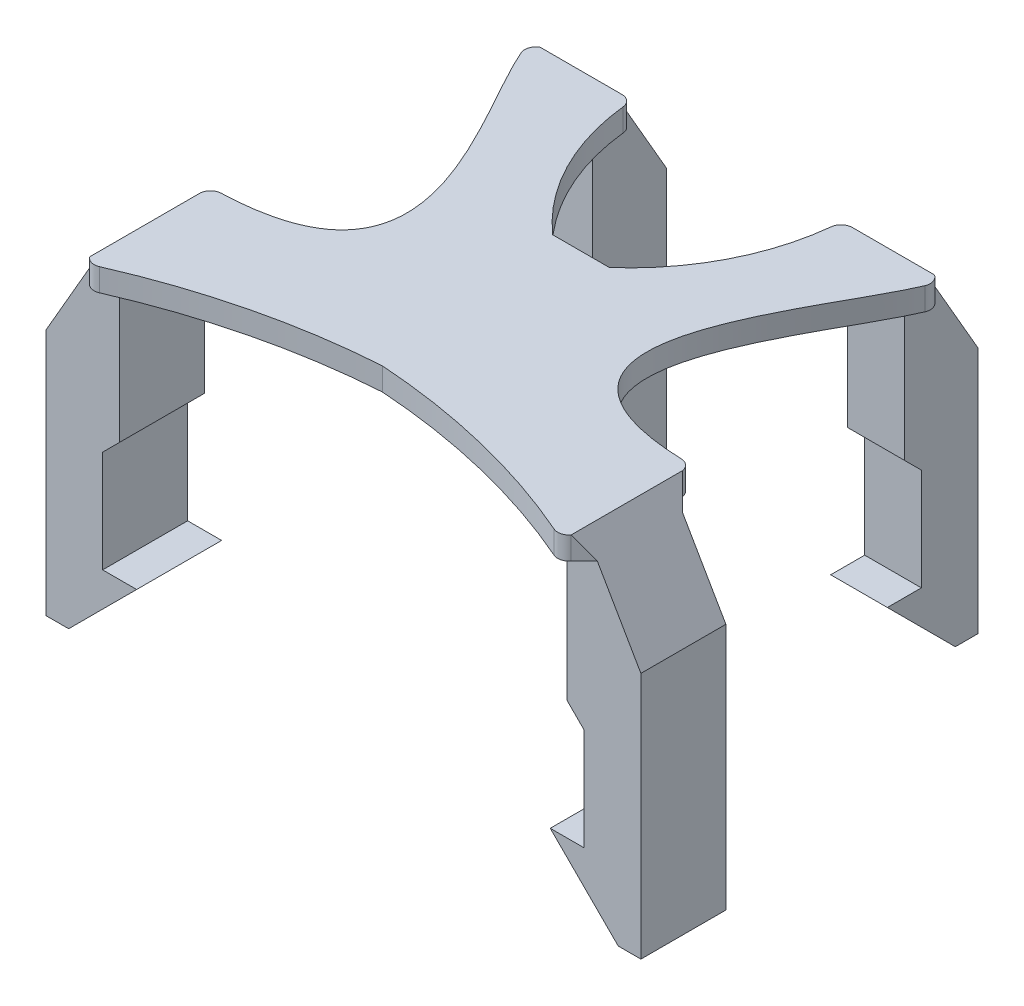
from build123d import *

# Parameters (mm, degrees)
SKETCH1_W           = 42.5
SKETCH1_H           = 44.5
BOSS_EXTRUDE1_DEPTH = 2
BOSS_EXTRUDE2_START = -27.25
BOSS_EXTRUDE2_DEPTH = 7.5
BOSS_EXTRUDE3_START = -5
BOSS_EXTRUDE3_DEPTH = 5
CUT_EXTRUDE3_DEPTH  = 5
CHAMFER1_SIZE       = 1.15
FILLET1_R           = 1


with BuildPart() as part:
    # Sketch1 → Boss-Extrude1 (new body)
    with BuildSketch(Plane(origin=(0, 0, 0), x_dir=(1, 0, 0), z_dir=(0, 1, 0))):
        Rectangle(SKETCH1_W, SKETCH1_H)
    extrude(amount=BOSS_EXTRUDE1_DEPTH)

    # Sketch2 → Boss-Extrude2 (add)
    with BuildSketch(Plane(origin=(0, 0, -22.25), x_dir=(-1, 0, 0), z_dir=(0, 0, -1)).offset(BOSS_EXTRUDE2_START)):
        Polygon((21.25, -22.5), (18.25, -22.5), (24.25, -28.5), (26.25, -28.5), (26.25, -18), (26.25, -6.660254038), (21.25, 2), (21.25, 0), (19.75, 0), (19.75, -12), (21.25, -13.5), align=None)
    boss_extrude2 = extrude(amount=-BOSS_EXTRUDE2_DEPTH)

    # Mirror1: Boss-Extrude2 across plane
    add(boss_extrude2.mirror(Plane(origin=(0, 0, 0), x_dir=(0, 0, 1), z_dir=(1, 0, 0))))

    # Sketch4 → Boss-Extrude3 (add)
    with BuildSketch(Plane(origin=(21.25, 0, 0), x_dir=(0, 0, -1), z_dir=(1, 0, 0)).offset(BOSS_EXTRUDE3_START)):
        Polygon((27.25, -6.660254038), (27.25, -28.5), (25.25, -28.5), (19.25, -22.5), (22.25, -22.5), (22.25, -13.5), (20.75, -12), (20.75, 0), (22.25, 0), (22.25, 2), align=None)
    boss_extrude3 = extrude(amount=-BOSS_EXTRUDE3_DEPTH)

    # Mirror2: Boss-Extrude3 across plane
    add(boss_extrude3.mirror(Plane(origin=(0, 0, 0), x_dir=(0, 0, 1), z_dir=(1, 0, 0))))

    # Sketch5 → Cut-Extrude3 (cut)
    with BuildSketch(Plane(origin=(0, 2, 0), x_dir=(1, 0, 0), z_dir=(0, 1, 0))):
        with BuildLine():
            ThreePointArc((0, -9.063025703), (-10.875563664, -10.802203854), (-21.25, -14.5))
            Line((-21.25, -14.5), (-21.25, -22.25))
            Line((-21.25, -22.25), (21.25, -22.25))
            Line((21.25, -22.25), (21.25, -14.5))
            ThreePointArc((21.25, -14.5), (10.875563664, -10.802203854), (0, -9.063025703))
        make_face()
        with BuildLine():
            Line((-21.25, 22.25), (-21.25, -3))
            add(Edge.make_bspline(
                [(-18.25, 22.25), (-16.81830639, 16.418600695), (-0.036255197, -2.877473786), (-21.25, -3)],
                knots=[0, 0, 0, 0, 1, 1, 1, 1], degree=3))
            Line((-18.25, 22.25), (-21.25, 22.25))
        make_face()
        with BuildLine():
            Line((-2.5, 8.468152214), (2.5, 8.468152214))
            ThreePointArc((2.5, 8.468152214), (7.249445146, 14.685907684), (9.25, 22.25))
            Line((9.25, 22.25), (-9.25, 22.25))
            ThreePointArc((-9.25, 22.25), (-7.249445146, 14.685907684), (-2.5, 8.468152214))
        make_face()
        with BuildLine():
            add(Edge.make_bspline(
                [(18.25, 22.25), (16.81830639, 16.418600695), (0.036255197, -2.877473786), (21.25, -3)],
                knots=[0, 0, 0, 0, 1, 1, 1, 1], degree=3))
            Line((21.25, -3), (21.25, 22.25))
            Line((21.25, 22.25), (18.25, 22.25))
        make_face()
    extrude(amount=-CUT_EXTRUDE3_DEPTH, mode=Mode.SUBTRACT)

    # Chamfer1
    chamfer1_edges = [part.edges().sort_by_distance(p)[0] for p in [
        (-11.25, 1, -22.25),
        (-21.25, 1, 12.5),
        (-21.25, 1, 5),
        (21.25, 1, 5),
        (21.25, 1, 12.5),
        (11.25, 1, -22.25),
        (16.25, 1, -22.25),
        (-16.25, 1, -22.25),
    ]]
    chamfer(chamfer1_edges, length=CHAMFER1_SIZE)

    # Fillet1
    # the kernel refuses this fillet: 1 mm, written as the material it takes off along each edge
    with BuildSketch(Plane(origin=(-21.25, 4.391127169, 3), x_dir=(0, 0, 1), z_dir=(0, -1, 0))) as fillet1_piece_1:
        with BuildLine():
            CenterArc((0.980089216, -0.991502292), FILLET1_R, 97.474747775, 80.505389302)
            Line((-0.019289453, -0.956256336), (-0.039277026, -0.955551417))
            ThreePointArc((-0.039277026, -0.955551417), (-0.026119359, -0.477798689), (-0.019999666, 0.000115514))
            Line((-0.019999666, 0.000115514), (0, 0.02))
            ThreePointArc((0, 0.02), (0.425, 0.02), (0.847398216, 0.019830046))
            Line((0.847398216, 0.019830046), (0.85, 0))
        make_face()
    extrude(amount=6.782254339, mode=Mode.SUBTRACT)
    with BuildSketch(Plane(origin=(-18.25, 5.318683713, -22.25), x_dir=(0.3309539081211192, 0, 0.9436469205690006), z_dir=(0, -1, 0))) as fillet1_piece_2:
        with BuildLine():
            CenterArc((1.261964238, -0.997851962), FILLET1_R, 86.243906852, 82.467431806)
            Line((0.281310822, -0.802099882), (0.261697754, -0.798184841))
            ThreePointArc((0.261697754, -0.798184841), (0.121782473, -0.407669019), (-0.018872938, -0.006619078))
            Line((-0.018872938, -0.006619078), (-0.001928232, 0.019906831))
            ThreePointArc((-0.001928232, 0.019906831), (0.664077557, 0.04586364), (1.32878367, 0.019957039))
            Line((1.32878367, 0.019957039), (1.327473485, 0))
        make_face()
    extrude(amount=8.637367425, mode=Mode.SUBTRACT)
    with BuildSketch(Plane(origin=(-9.25, 4.236352912, -22.25), x_dir=(-1, 0, 0), z_dir=(0, -1, 0))) as fillet1_piece_3:
        with BuildLine():
            CenterArc((0.919243583, -0.997599783), FILLET1_R, 93.970542278, 79.932192876)
            Line((-0.075099433, -0.891383179), (-0.094986293, -0.889258846))
            ThreePointArc((-0.094986293, -0.889258846), (-0.052494869, -0.444432453), (-0.01996196, 0.001232949))
            Line((-0.01996196, 0.001232949), (0, 0.02))
            ThreePointArc((0, 0.02), (0.425, 0.02), (0.848615128, 0.019951996))
            Line((0.848615128, 0.019951996), (0.85, 0))
        make_face()
    extrude(amount=6.472705825, mode=Mode.SUBTRACT)
    with BuildSketch(Plane(origin=(9.25, 4.236352912, -22.25), x_dir=(-0.08395302082723771, 0, 0.9964697136862621), z_dir=(0, -1, 0))) as fillet1_piece_4:
        with BuildLine():
            CenterArc((0.916904694, -0.999749905), FILLET1_R, 91.281442663, 79.932192876)
            Line((-0.071360068, -0.846999257), (-0.091125363, -0.843944244))
            ThreePointArc((-0.091125363, -0.843944244), (-0.055609428, -0.421820568), (-0.019929394, 0.00167906))
            Line((-0.019929394, 0.00167906), (0.000447271, 0.019994998))
            ThreePointArc((0.000447271, 0.019994998), (0.447270582, 0.0149981), (0.894093894, 0.019994998))
            Line((0.894093894, 0.019994998), (0.894541165, 0))
        make_face()
    extrude(amount=6.472705825, mode=Mode.SUBTRACT)
    with BuildSketch(Plane(origin=(18.25, 5.318683713, -22.25), x_dir=(-1, 0, 0), z_dir=(0, -1, 0))) as fillet1_piece_5:
        with BuildLine():
            CenterArc((1.359271928, -0.860605661), FILLET1_R, 120.615345392, 82.467431806)
            Line((0.439332538, -1.252666266), (0.42093375, -1.260507478))
            ThreePointArc((0.42093375, -1.260507478), (0.17649998, -0.641833493), (-0.019423176, -0.004768673))
            Line((-0.019423176, -0.004768673), (0, 0.02))
            ThreePointArc((0, 0.02), (0.425, 0.02), (0.839814561, 0.017212113))
            Line((0.839814561, 0.017212113), (0.85, 0))
        make_face()
    extrude(amount=8.637367425, mode=Mode.SUBTRACT)
    with BuildSketch(Plane(origin=(21.25, 4.391127169, 3), x_dir=(-0.9997966104440278, 0, -0.020167740196489006), z_dir=(0, -1, 0))) as fillet1_piece_6:
        with BuildLine():
            CenterArc((0.971534447, -0.999886236), FILLET1_R, 90.864258181, 80.505389302)
            Line((-0.017142579, -0.849827119), (-0.03691612, -0.846825937))
            ThreePointArc((-0.03691612, -0.846825937), (-0.028567222, -0.424510205), (-0.019995932, 0.000403355))
            Line((-0.019995932, 0.000403355), (0.000287858, 0.019997928))
            ThreePointArc((0.000287858, 0.019997928), (0.478228278, 0.016477927), (0.956149196, 0.019997725))
            Line((0.956149196, 0.019997725), (0.956450868, 0))
        make_face()
    extrude(amount=6.782254339, mode=Mode.SUBTRACT)
    with BuildSketch(Plane(origin=(21.25, 5.281576595, 14.5), x_dir=(0, 0, -1), z_dir=(0, -1, 0))) as fillet1_piece_7:
        with BuildLine():
            CenterArc((1.455421085, -0.79590534), FILLET1_R, 127.259148945, 76.371212097)
            Line((0.539270629, -1.196739897), (0.52094762, -1.204756588))
            ThreePointArc((0.52094762, -1.204756588), (0.254673852, -0.605111829), (-0.018143252, -0.008415604))
            Line((-0.018143252, -0.008415604), (0, 0.02))
            ThreePointArc((0, 0.02), (0.425, 0.02), (0.837891578, 0.015918107))
            Line((0.837891578, 0.015918107), (0.85, 0))
        make_face()
    extrude(amount=8.56315319, mode=Mode.SUBTRACT)
    with BuildSketch(Plane(origin=(-21.25, 5.281576595, 14.5), x_dir=(0, 0, -1), z_dir=(0, -1, 0))) as fillet1_piece_8:
        with BuildLine():
            CenterArc((1.455421085, 0.79590534), FILLET1_R, 156.369638958, 76.371212097)
            Line((0.539270629, 1.196739897), (0.52094762, 1.204756588))
            ThreePointArc((0.52094762, 1.204756588), (0.254673852, 0.605111829), (-0.018143252, 0.008415604))
            Line((-0.018143252, 0.008415604), (0, -0.02))
            ThreePointArc((0, -0.02), (0.425, -0.02), (0.837891578, -0.015918107))
            Line((0.837891578, -0.015918107), (0.85, 0))
        make_face()
    extrude(amount=8.56315319, mode=Mode.SUBTRACT)


solid = part.part
